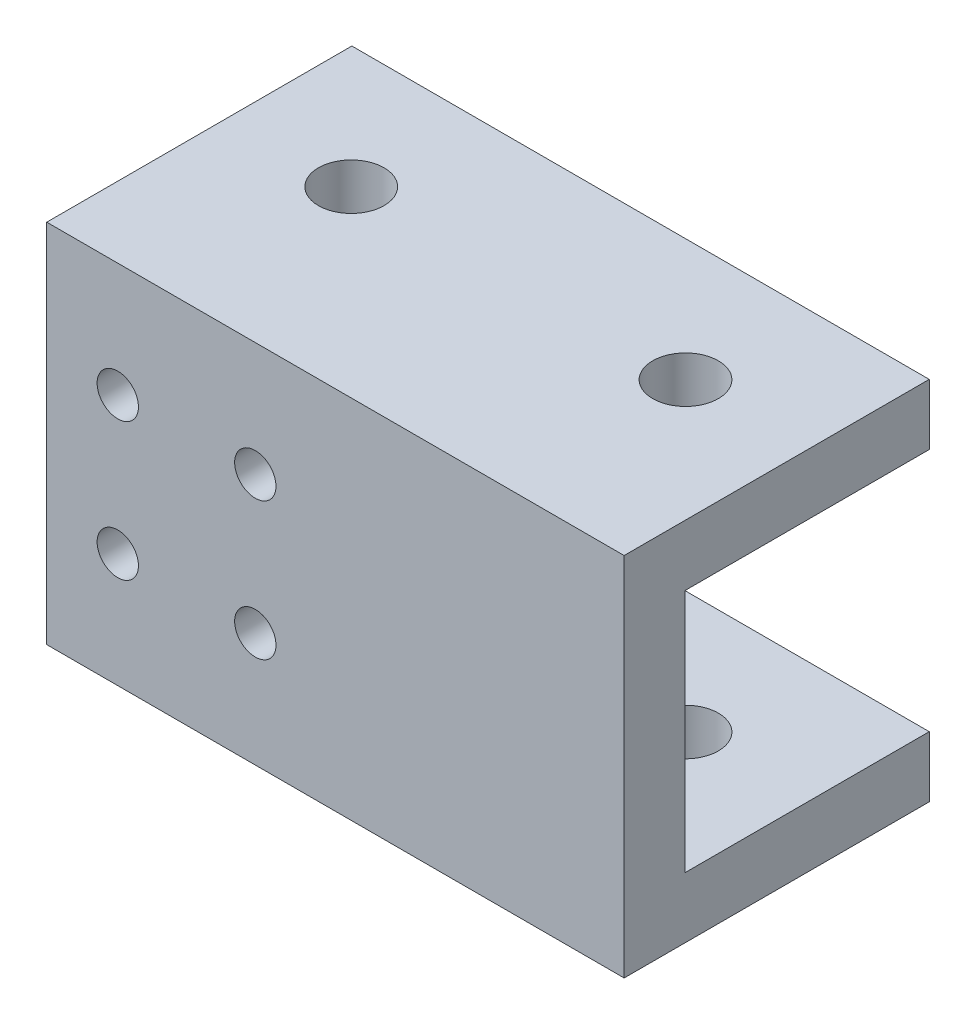
from build123d import *

# Parameters (mm, degrees)
BOSS_EXTRUDE1_DEPTH                             = 47.5
CSK_FOR_M3_FLAT_HEAD_MACHINE_SCREW1_D           = 3.4
CSK_FOR_M3_FLAT_HEAD_MACHINE_SCREW1_CSINK_D     = 6.3
CSK_FOR_M3_FLAT_HEAD_MACHINE_SCREW1_CSINK_ANGLE = 90
SKETCH5_R                                       = 2.7
CUT_EXTRUDE1_DEPTH                              = 59.213078427


with BuildPart() as part:
    # Sketch1 → Boss-Extrude1 (new body)
    with BuildSketch(Plane(origin=(0, 0, 0), x_dir=(0, 0, -1), z_dir=(1, 0, 0))):
        Polygon((10.05, -10.05), (10.05, -15.05), (-15.05, -15.05), (-15.05, 15.05), (10.05, 15.05), (10.05, 10.05), (-10.05, 10.05), (-10.05, -10.05), align=None)
    extrude(amount=BOSS_EXTRUDE1_DEPTH)

    # CSK for M3 Flat Head Machine Screw1 (through all)
    with Locations(Plane(origin=(0, 0, 10.05), x_dir=(-1, 0, 0), z_dir=(0, 0, -1))):
        with Locations((-17.156854249, 5.656854249), (-5.843145751, 5.656854249), (-5.843145751, -5.656854249), (-17.156854249, -5.656854249)):
            CounterSinkHole(CSK_FOR_M3_FLAT_HEAD_MACHINE_SCREW1_D / 2, CSK_FOR_M3_FLAT_HEAD_MACHINE_SCREW1_CSINK_D / 2, counter_sink_angle=CSK_FOR_M3_FLAT_HEAD_MACHINE_SCREW1_CSINK_ANGLE)

    # Sketch5 → Cut-Extrude1 (cut, through all)
    with BuildSketch(Plane(origin=(0, 15.05, 0), x_dir=(1, 0, 0), z_dir=(0, 1, 0))):
        with Locations((10, 0)):
            Circle(SKETCH5_R)
        with Locations((37.5, 0)):
            Circle(SKETCH5_R)
    extrude(amount=-CUT_EXTRUDE1_DEPTH, mode=Mode.SUBTRACT)


solid = part.part
